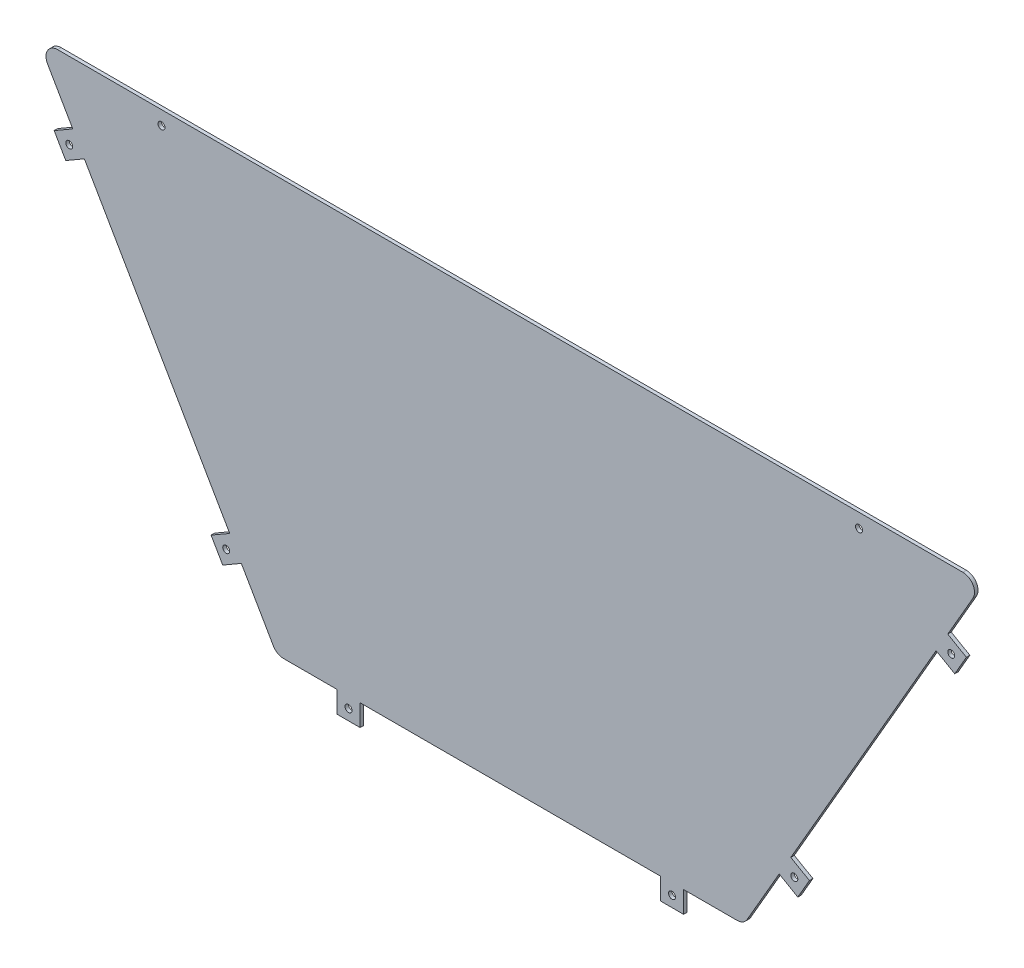
from build123d import *

# Parameters (mm, degrees)
SKETCH_1_R              = 3
EXTRUDE_1_DEPTH         = 1.5
SHEET_START             = -1.5
SHEET_METAL_1_OUTLINE_R = 3
SHEET_METAL_1_DEPTH     = 1.5


# Read off the part's stored shape, not the designer's step: Преобразовать-Твердое тело1
with BuildPart() as part:
    # Sketch 1 → Бобышка-Вытянуть1 (new body)
    with BuildSketch(Plane.XY):
        with BuildLine():
            Line((389.31902002, 22), (-389.31902002, 22))
            ThreePointArc((-389.31902002, 22), (-397.979274058, 17), (-397.979274058, 7))
            Line((-397.979274058, 7), (-376.299038106, -30.551270189))
            Line((-376.299038106, -30.551270189), (-392.320508076, -39.801270189))
            Line((-392.320508076, -39.801270189), (-382.320508076, -57.121778265))
            Line((-382.320508076, -57.121778265), (-366.299038106, -47.871778265))
            Line((-366.299038106, -47.871778265), (-241.299038106, -264.378129211))
            Line((-241.299038106, -264.378129211), (-257.320508076, -273.628129211))
            Line((-257.320508076, -273.628129211), (-247.320508076, -290.948637287))
            Line((-247.320508076, -290.948637287), (-231.299038106, -281.698637287))
            Line((-231.299038106, -281.698637287), (-203.75277675, -329.410161514))
            ThreePointArc((-203.75277675, -329.410161514), (-200.092522712, -333.070415552), (-195.092522712, -334.410161514))
            Line((-195.092522712, -334.410161514), (-149.133974596, -334.410161514))
            Line((-149.133974596, -334.410161514), (-149.133974596, -352.910161514))
            Line((-149.133974596, -352.910161514), (-129.133974596, -352.910161514))
            Line((-129.133974596, -352.910161514), (-129.133974596, -334.410161514))
            Line((-129.133974596, -334.410161514), (129.133974596, -334.410161514))
            Line((129.133974596, -334.410161514), (129.133974596, -352.910161514))
            Line((129.133974596, -352.910161514), (149.133974596, -352.910161514))
            Line((149.133974596, -352.910161514), (149.133974596, -334.410161514))
            Line((149.133974596, -334.410161514), (195.092522712, -334.410161514))
            ThreePointArc((195.092522712, -334.410161514), (200.092522712, -333.070415552), (203.75277675, -329.410161514))
            Line((203.75277675, -329.410161514), (231.299038106, -281.698637287))
            Line((231.299038106, -281.698637287), (247.320508076, -290.948637287))
            Line((247.320508076, -290.948637287), (257.320508076, -273.628129211))
            Line((257.320508076, -273.628129211), (241.299038106, -264.378129211))
            Line((241.299038106, -264.378129211), (366.299038106, -47.871778265))
            Line((366.299038106, -47.871778265), (382.320508076, -57.121778265))
            Line((382.320508076, -57.121778265), (392.320508076, -39.801270189))
            Line((392.320508076, -39.801270189), (376.299038106, -30.551270189))
            Line((376.299038106, -30.551270189), (397.979274058, 7))
            ThreePointArc((397.979274058, 7), (397.979274058, 17), (389.31902002, 22))
        make_face()
        with Locations((244.309773091, -277.663383249)):
            Circle(SKETCH_1_R, mode=Mode.SUBTRACT)
        with Locations((379.309773091, -43.836524227)):
            Circle(SKETCH_1_R, mode=Mode.SUBTRACT)
        with Locations((139.133974596, -343.660161514)):
            Circle(SKETCH_1_R, mode=Mode.SUBTRACT)
        with Locations((-139.133974596, -343.660161514)):
            Circle(SKETCH_1_R, mode=Mode.SUBTRACT)
        with Locations((-244.309773091, -277.663383249)):
            Circle(SKETCH_1_R, mode=Mode.SUBTRACT)
        with Locations((-379.309773091, -43.836524227)):
            Circle(SKETCH_1_R, mode=Mode.SUBTRACT)
        with Locations((300, 10)):
            Circle(SKETCH_1_R, mode=Mode.SUBTRACT)
        with Locations((-300, 10)):
            Circle(SKETCH_1_R, mode=Mode.SUBTRACT)
    extrude(amount=EXTRUDE_1_DEPTH)

    # Sheet Metal 1 outline → Sheet Metal 1 (add)
    with BuildSketch(Plane.XY.offset(SHEET_START)):
        with BuildLine():
            Line((-149.133974596, -334.410161514), (-149.133974596, -352.910161514))
            Line((-149.133974596, -352.910161514), (-129.133974596, -352.910161514))
            Line((-129.133974596, -352.910161514), (-129.133974596, -334.410161514))
            Line((-129.133974596, -334.410161514), (129.133974596, -334.410161514))
            Line((129.133974596, -334.410161514), (129.133974596, -352.910161514))
            Line((129.133974596, -352.910161514), (149.133974596, -352.910161514))
            Line((149.133974596, -352.910161514), (149.133974596, -334.410161514))
            Line((149.133974596, -334.410161514), (195.092522712, -334.410161514))
            ThreePointArc((195.092522712, -334.410161514), (200.092522712, -333.070415552), (203.75277675, -329.410161514))
            Line((203.75277675, -329.410161514), (231.299038106, -281.698637287))
            Line((231.299038106, -281.698637287), (247.320508076, -290.948637287))
            Line((247.320508076, -290.948637287), (257.320508076, -273.628129211))
            Line((257.320508076, -273.628129211), (241.299038106, -264.378129211))
            Line((241.299038106, -264.378129211), (366.299038106, -47.871778265))
            Line((366.299038106, -47.871778265), (382.320508076, -57.121778265))
            Line((382.320508076, -57.121778265), (392.320508076, -39.801270189))
            Line((392.320508076, -39.801270189), (376.299038106, -30.551270189))
            Line((376.299038106, -30.551270189), (397.979274058, 7))
            ThreePointArc((397.979274058, 7), (397.979274058, 17), (389.31902002, 22))
            Line((389.31902002, 22), (-389.31902002, 22))
            ThreePointArc((-389.31902002, 22), (-397.979274058, 17), (-397.979274058, 7))
            Line((-397.979274058, 7), (-376.299038106, -30.551270189))
            Line((-376.299038106, -30.551270189), (-392.320508076, -39.801270189))
            Line((-392.320508076, -39.801270189), (-382.320508076, -57.121778265))
            Line((-382.320508076, -57.121778265), (-366.299038106, -47.871778265))
            Line((-366.299038106, -47.871778265), (-241.299038106, -264.378129211))
            Line((-241.299038106, -264.378129211), (-257.320508076, -273.628129211))
            Line((-257.320508076, -273.628129211), (-247.320508076, -290.948637287))
            Line((-247.320508076, -290.948637287), (-231.299038106, -281.698637287))
            Line((-231.299038106, -281.698637287), (-203.75277675, -329.410161514))
            ThreePointArc((-203.75277675, -329.410161514), (-200.092522712, -333.070415552), (-195.092522712, -334.410161514))
            Line((-195.092522712, -334.410161514), (-149.133974596, -334.410161514))
        make_face()
        with Locations((-244.309773091, -277.663383249)):
            Circle(SHEET_METAL_1_OUTLINE_R, mode=Mode.SUBTRACT)
        with Locations((-139.133974596, -343.660161514)):
            Circle(SHEET_METAL_1_OUTLINE_R, mode=Mode.SUBTRACT)
        with Locations((139.133974596, -343.660161514)):
            Circle(SHEET_METAL_1_OUTLINE_R, mode=Mode.SUBTRACT)
        with Locations((244.309773091, -277.663383249)):
            Circle(SHEET_METAL_1_OUTLINE_R, mode=Mode.SUBTRACT)
        with Locations((-379.309773091, -43.836524227)):
            Circle(SHEET_METAL_1_OUTLINE_R, mode=Mode.SUBTRACT)
        with Locations((-300, 10)):
            Circle(SHEET_METAL_1_OUTLINE_R, mode=Mode.SUBTRACT)
        with Locations((379.309773091, -43.836524227)):
            Circle(SHEET_METAL_1_OUTLINE_R, mode=Mode.SUBTRACT)
        with Locations((300, 10)):
            Circle(SHEET_METAL_1_OUTLINE_R, mode=Mode.SUBTRACT)
    extrude(amount=SHEET_METAL_1_DEPTH)


solid = part.part
